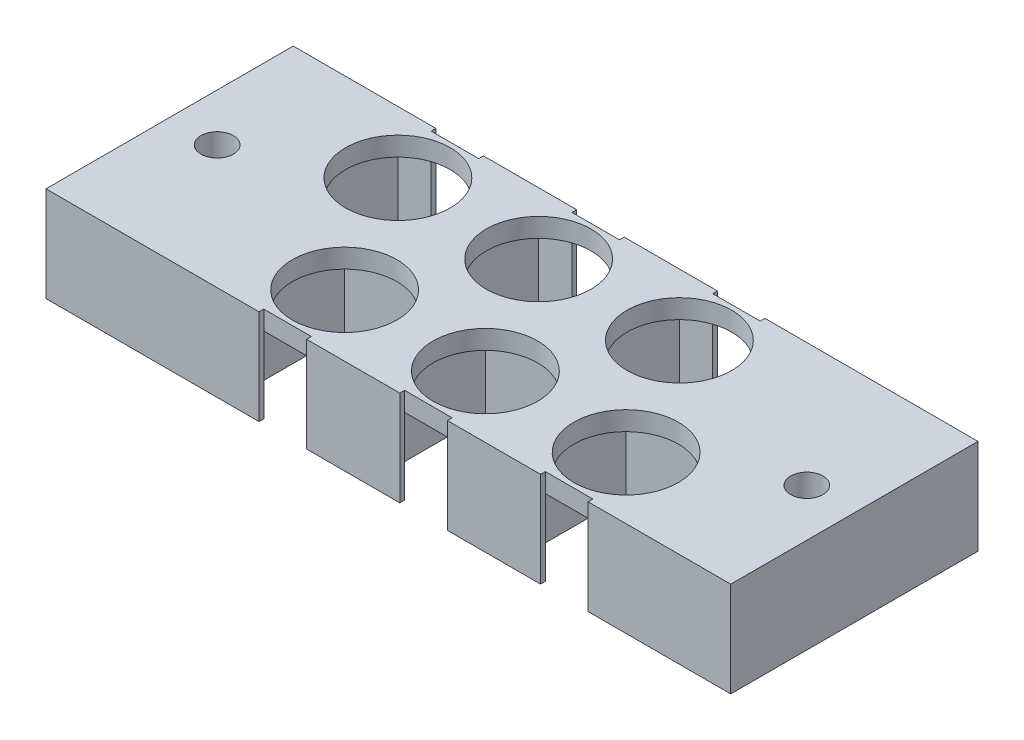
from build123d import *

# Parameters (mm, degrees)
SKETCH1_W               = 12
SKETCH1_H               = 12
SKETCH1_R               = 5.5
BOSS_EXTRUDE1_DEPTH     = 2
BOSS_EXTRUDE1_2_DEPTH   = 2
BOSS_EXTRUDE1_3_DEPTH   = 2
BOSS_EXTRUDE1_4_DEPTH   = 2
BOSS_EXTRUDE1_5_DEPTH   = 2
BOSS_EXTRUDE1_6_DEPTH   = 2
BOSS_EXTRUDE2_START     = -10
BOSS_EXTRUDE2_OUTLINE_R = 1.7
BOSS_EXTRUDE2_DEPTH     = 10
CUT_EXTRUDE1_DEPTH      = 1


# Read off the part's stored shape, not the designer's step: Boss-Extrude2
with BuildPart() as part:
    # Sketch1 → Boss-Extrude1 (new body)
    with BuildSketch(Plane(origin=(0, 0, 0), x_dir=(1, 0, 0), z_dir=(0, 1, 0))):
        with Locations((13.686388819, -10.664882883)):
            Rectangle(SKETCH1_W, SKETCH1_H)
        with Locations(Location((13.686388819, -10.664882883, 0), (0, 0, 270))):
            Circle(SKETCH1_R, mode=Mode.SUBTRACT)
    extrude(amount=-BOSS_EXTRUDE1_DEPTH)



with BuildPart() as body_2:
    # Sketch1 → Boss-Extrude1 2 (new body)
    with BuildSketch(Plane(origin=(0, 0, 0), x_dir=(1, 0, 0), z_dir=(0, 1, 0))):
        with Locations((-1.113611181, -10.664882883)):
            Rectangle(SKETCH1_W, SKETCH1_H)
        with Locations(Location((-1.113611181, -10.664882883, 0), (0, 0, 270))):
            Circle(SKETCH1_R, mode=Mode.SUBTRACT)
    extrude(amount=-BOSS_EXTRUDE1_2_DEPTH)


with BuildPart() as body_3:
    # Sketch1 → Boss-Extrude1 3 (new body)
    with BuildSketch(Plane(origin=(0, 0, 0), x_dir=(1, 0, 0), z_dir=(0, 1, 0))):
        with Locations((6.28638882, -23.664882883)):
            Rectangle(SKETCH1_W, SKETCH1_H)
        with Locations(Location((6.28638882, -23.664882883, 0), (0, 0, 270))):
            Circle(SKETCH1_R, mode=Mode.SUBTRACT)
    extrude(amount=-BOSS_EXTRUDE1_3_DEPTH)


with BuildPart() as body_4:
    # Sketch1 → Boss-Extrude1 4 (new body)
    with BuildSketch(Plane(origin=(0, 0, 0), x_dir=(1, 0, 0), z_dir=(0, 1, 0))):
        with Locations((21.08638882, -23.664882883)):
            Rectangle(SKETCH1_W, SKETCH1_H)
        with Locations(Location((21.08638882, -23.664882883, 0), (0, 0, 270))):
            Circle(SKETCH1_R, mode=Mode.SUBTRACT)
    extrude(amount=-BOSS_EXTRUDE1_4_DEPTH)


with BuildPart() as body_5:
    # Sketch1 → Boss-Extrude1 5 (new body)
    with BuildSketch(Plane(origin=(0, 0, 0), x_dir=(1, 0, 0), z_dir=(0, 1, 0))):
        with Locations((35.88638882, -23.664882883)):
            Rectangle(SKETCH1_W, SKETCH1_H)
        with Locations(Location((35.88638882, -23.664882883, 0), (0, 0, 270))):
            Circle(SKETCH1_R, mode=Mode.SUBTRACT)
    extrude(amount=-BOSS_EXTRUDE1_5_DEPTH)


with BuildPart() as body_6:
    # Sketch1 → Boss-Extrude1 6 (new body)
    with BuildSketch(Plane(origin=(0, 0, 0), x_dir=(1, 0, 0), z_dir=(0, 1, 0))):
        with Locations((28.486388819, -10.664882883)):
            Rectangle(SKETCH1_W, SKETCH1_H)
        with Locations(Location((28.486388819, -10.664882883, 0), (0, 0, 270))):
            Circle(SKETCH1_R, mode=Mode.SUBTRACT)
    extrude(amount=-BOSS_EXTRUDE1_6_DEPTH)


with BuildPart() as part_1:
    add(part.part)

    add(body_2.part)  # Boss-Extrude2 merges body 2

    add(body_3.part)  # Boss-Extrude2 merges body 3

    add(body_4.part)  # Boss-Extrude2 merges body 4

    add(body_5.part)  # Boss-Extrude2 merges body 5

    add(body_6.part)  # Boss-Extrude2 merges body 6
    # Boss-Extrude2 outline → Boss-Extrude2 (add)
    with BuildSketch(Plane(origin=(0, 0, 0), x_dir=(1, 0, 0), z_dir=(0, 1, 0)).offset(BOSS_EXTRUDE2_START)):
        Polygon((22.486388819, -4.664882883), (25.986388819, -4.664882883), (25.986388819, -4.164882883), (16.186388819, -4.164882883), (16.186388819, -4.664882883), (19.686388819, -4.664882883), (19.686388819, -16.664882883), (7.686388819, -16.664882883), (7.686388819, -4.664882883), (11.186388819, -4.664882883), (11.186388819, -4.164882883), (1.386388819, -4.164882883), (1.386388819, -4.664882883), (4.886388819, -4.664882883), (4.886388819, -16.664882883), (-7.113611181, -16.664882883), (-7.113611181, -4.664882883), (-3.613611181, -4.664882883), (-3.613611181, -4.164882883), (-18.613611181, -4.164883527), (-18.613611181, -30.164882449), (3.78638882, -30.164882883), (3.78638882, -29.664882883), (0.28638882, -29.664882883), (0.28638882, -17.664882883), (12.28638882, -17.664882883), (12.28638882, -29.664882883), (8.78638882, -29.664882883), (8.78638882, -30.164882883), (18.58638882, -30.164882883), (18.58638882, -29.664882883), (15.08638882, -29.664882883), (15.08638882, -17.664882883), (27.08638882, -17.664882883), (27.08638882, -29.664882883), (23.58638882, -29.664882883), (23.58638882, -30.164882883), (33.38638882, -30.164882883), (33.38638882, -29.664882883), (29.88638882, -29.664882883), (29.88638882, -17.664882883), (41.88638882, -17.664882883), (41.88638882, -29.664882883), (38.38638882, -29.664882883), (38.38638882, -30.164882883), (53.38638882, -30.164882883), (53.38638882, -4.164882883), (30.986388819, -4.164882883), (30.986388819, -4.664882883), (34.486388819, -4.664882883), (34.486388819, -16.664882883), (22.486388819, -16.664882883), align=None)
        with Locations((-13.613611181, -17.164882988)):
            Circle(BOSS_EXTRUDE2_OUTLINE_R, mode=Mode.SUBTRACT)
        with Locations((48.386388819, -17.164882988)):
            Circle(BOSS_EXTRUDE2_OUTLINE_R, mode=Mode.SUBTRACT)
    extrude(amount=BOSS_EXTRUDE2_DEPTH)

    # Sketch2 → Cut-Extrude1 (cut)
    with BuildSketch(Plane.XZ.offset(10)):
        Polygon((-11.090813446, 25.393846705), (-9.544018575, 25.393846705), (-9.544018575, 25.068205679), (-10.805877549, 25.068205679), (-10.805877549, 24.091282602), (-9.544018575, 24.091282602), (-9.544018575, 23.765641577), (-10.805877549, 23.765641577), (-10.805877549, 22.218846705), (-11.090813446, 22.218846705), align=None)
        with BuildLine():
            Line((-8.852031395, 24.416923628), (-9.136967293, 24.416923628))
            add(Edge.make_bspline(
                [(-9.136967293, 24.416923628), (-9.135110232, 24.454725076), (-9.131463015, 24.528966114), (-9.114383067, 24.637209944), (-9.089943843, 24.74067394), (-9.055389453, 24.838527362), (-9.012475901, 24.931635423), (-8.961013662, 25.019628294), (-8.90005924, 25.102170301), (-8.830928846, 25.178496252), (-8.755845866, 25.248516405), (-8.674832621, 25.308982233), (-8.589701775, 25.360070406), (-8.500711605, 25.402779818), (-8.406858094, 25.434838107), (-8.30899293, 25.45862488), (-8.206686142, 25.472936279), (-8.136981265, 25.474474599), (-8.101530594, 25.475256961)],
                knots=[0, 0, 0, 0, 1.10065271, 2.161652631, 3.183658789, 4.190468796, 5.17591951, 6.163126047, 7.15150782, 8.156236427, 9.156009102, 10.134482811, 11.092018607, 12.041330605, 13.001268258, 13.972401359, 14.968799086, 16, 16, 16, 16], degree=3))
            add(Edge.make_bspline(
                [(-8.101530594, 25.475256961), (-8.066716198, 25.474441933), (-7.998307154, 25.472840431), (-7.898465184, 25.459087212), (-7.803417209, 25.437546568), (-7.713349021, 25.407324726), (-7.628979234, 25.366698853), (-7.549674044, 25.3178968), (-7.474489308, 25.261454524), (-7.406810297, 25.195002851), (-7.344663683, 25.124062116), (-7.291049494, 25.048326661), (-7.245136124, 24.97010438), (-7.206865872, 24.888798797), (-7.178693517, 24.803644364), (-7.157304714, 24.71588083), (-7.145214846, 24.624599752), (-7.143359355, 24.562817376), (-7.142416011, 24.531406801)],
                knots=[0, 0, 0, 0, 1.111607364, 2.184268762, 3.212621178, 4.221274766, 5.211760367, 6.196651075, 7.1921475, 8.207485113, 9.220403448, 10.201281604, 11.166441695, 12.114753415, 13.065576456, 14.026450734, 14.996634279, 16, 16, 16, 16], degree=3))
            add(Edge.make_bspline(
                [(-7.142416011, 24.531406801), (-7.143946038, 24.48718376), (-7.146979244, 24.399513729), (-7.173155489, 24.270514062), (-7.21359782, 24.145414473), (-7.262649782, 24.044740618), (-7.31219844, 23.964025865), (-7.355904397, 23.896973819), (-7.408203317, 23.825466998), (-7.468616685, 23.748785207), (-7.536233124, 23.666693885), (-7.611539287, 23.579159348), (-7.695110449, 23.487111285), (-7.753764656, 23.424241012), (-7.784157797, 23.391663211)],
                knots=[0, 0, 0, 0, 1.184203166, 2.347625244, 3.513805382, 4.700623107, 5.337941753, 6.051866363, 6.845199593, 7.711357327, 8.668078039, 9.695487809, 10.805859518, 12, 12, 12, 12], degree=3))
            Line((-7.784157797, 23.391663211), (-8.578543815, 22.544487731))
            Line((-8.578543815, 22.544487731), (-7.101710882, 22.544487731))
            Line((-7.101710882, 22.544487731), (-7.101710882, 22.218846705))
            Line((-7.101710882, 22.218846705), (-9.259082677, 22.218846705))
            Line((-9.259082677, 22.218846705), (-8.027752549, 23.532859125))
            add(Edge.make_bspline(
                [(-8.027752549, 23.532859125), (-7.997773395, 23.564154017), (-7.940189574, 23.624265101), (-7.858743951, 23.712024786), (-7.785592869, 23.793440441), (-7.720262805, 23.868358238), (-7.664170983, 23.937874018), (-7.614394029, 23.999736356), (-7.574510957, 24.056663607), (-7.531226277, 24.122649736), (-7.489303594, 24.203215195), (-7.453278814, 24.301670756), (-7.431312487, 24.403023335), (-7.428677386, 24.471514469), (-7.427351908, 24.505966096)],
                knots=[0, 0, 0, 0, 1.329631726, 2.553950428, 3.673215718, 4.687767853, 5.603093632, 6.413772471, 7.123043292, 7.734684054, 8.834405432, 9.900288307, 10.943827018, 12, 12, 12, 12], degree=3))
            add(Edge.make_bspline(
                [(-7.427351908, 24.505966096), (-7.427928617, 24.527629936), (-7.4290652, 24.570325205), (-7.439096111, 24.632923286), (-7.454254927, 24.693307081), (-7.475976697, 24.751662329), (-7.504648526, 24.807402313), (-7.539549378, 24.860594884), (-7.579817506, 24.912019874), (-7.626400444, 24.960237509), (-7.677573751, 25.004398317), (-7.731634249, 25.043518023), (-7.7888297, 25.076210645), (-7.848918954, 25.103010817), (-7.911734487, 25.124034199), (-7.977397792, 25.138601624), (-8.045727435, 25.147747878), (-8.092384963, 25.148985376), (-8.116158999, 25.149615936)],
                knots=[0, 0, 0, 0, 0.991446411, 1.95395049, 2.89581595, 3.838931463, 4.798493298, 5.75982156, 6.748411868, 7.785213223, 8.824556874, 9.840280684, 10.836137867, 11.835679398, 12.848801643, 13.863922112, 14.911575587, 16, 16, 16, 16], degree=3))
            add(Edge.make_bspline(
                [(-8.116158999, 25.149615936), (-8.140988255, 25.148967299), (-8.189748813, 25.147693485), (-8.26133965, 25.138782925), (-8.329634605, 25.123410627), (-8.394805474, 25.102386072), (-8.456962527, 25.07566296), (-8.515803481, 25.042378306), (-8.571196245, 25.002660423), (-8.623244948, 24.957629347), (-8.671200129, 24.907493737), (-8.713334081, 24.851604699), (-8.75014958, 24.790982687), (-8.782270813, 24.725791273), (-8.808356332, 24.655438916), (-8.828289118, 24.580175355), (-8.844061472, 24.500327387), (-8.84933063, 24.445186632), (-8.852031395, 24.416923628)],
                knots=[0, 0, 0, 0, 1.031018746, 2.02475058, 2.990194455, 3.934040569, 4.864654155, 5.795059489, 6.735614925, 7.690564532, 8.649604399, 9.611025574, 10.590972636, 11.591080095, 12.624614302, 13.701020113, 14.821632451, 16, 16, 16, 16], degree=3))
        make_face()
    extrude(amount=-CUT_EXTRUDE1_DEPTH, mode=Mode.SUBTRACT)


solid = part_1.part
